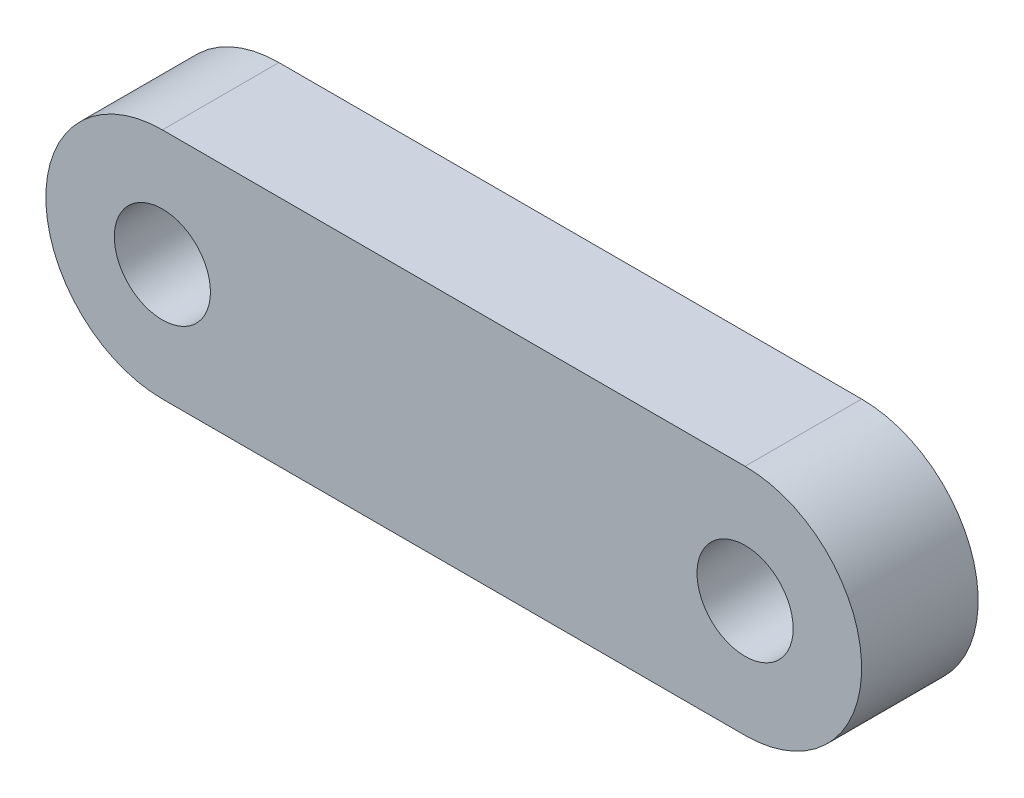
from build123d import *

# Parameters (mm, degrees)
SKETCH1_R           = 1.65
BOSS_EXTRUDE1_DEPTH = 4


with BuildPart() as part:
    # Sketch1 → Boss-Extrude1 (new body)
    with BuildSketch(Plane.XY):
        with BuildLine():
            Line((-20, 4), (0, 4))
            ThreePointArc((0, 4), (4, 0), (0, -4))
            Line((0, -4), (-20, -4))
            ThreePointArc((-20, -4), (-24, 0), (-20, 4))
        make_face()
        Circle(SKETCH1_R, mode=Mode.SUBTRACT)
        with Locations((-20, 0)):
            Circle(SKETCH1_R, mode=Mode.SUBTRACT)
    extrude(amount=BOSS_EXTRUDE1_DEPTH)


solid = part.part
